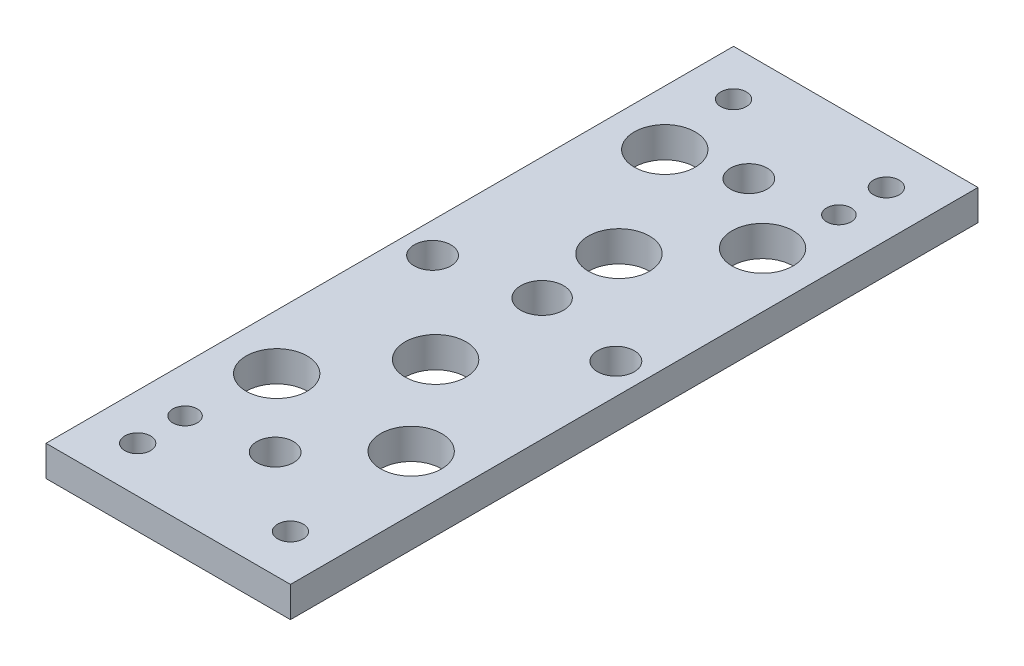
from build123d import *

# Parameters (mm, degrees)
SKETCH1_W             = 80
SKETCH1_H             = 225
BOSS_EXTRUDE1_DEPTH   = 10
CUT_EXTRUDE1_REACH    = 121.818
SKETCH2_R             = 6
M8_CLEARANCE_HOLE1_D  = 8.4
F_8_0MM_DOWEL_HOLE1_D = 8
CUT_EXTRUDE3_REACH    = 121.818
SKETCH10_R            = 7
SKETCH14_R            = 10
CUT_EXTRUDE4_DEPTH    = 120.817569663


with BuildPart() as part:
    # Sketch1 → Boss-Extrude1 (new body)
    with BuildSketch(Plane(origin=(0, 0, 0), x_dir=(1, 0, 0), z_dir=(0, 1, 0))):
        Rectangle(SKETCH1_W, SKETCH1_H)
    extrude(amount=-BOSS_EXTRUDE1_DEPTH)

    # Sketch2 → Cut-Extrude1 (cut, up to next)
    with BuildSketch(Plane(origin=(0, 0, 0), x_dir=(1, 0, 0), z_dir=(0, 1, 0)), mode=Mode.PRIVATE) as cut_extrude1_sk1:
        with Locations((0, 77.5)):
            Circle(SKETCH2_R)
    cut_extrude1_tool1 = extrude(cut_extrude1_sk1.sketch, amount=-CUT_EXTRUDE1_REACH, mode=Mode.PRIVATE) & part.part
    # Sketch2 → Cut-Extrude1 (cut, up to next)
    with BuildSketch(Plane(origin=(0, 0, 0), x_dir=(1, 0, 0), z_dir=(0, 1, 0)), mode=Mode.PRIVATE) as cut_extrude1_sk2:
        with Locations((30, 4)):
            Circle(SKETCH2_R)
    cut_extrude1_tool2 = extrude(cut_extrude1_sk2.sketch, amount=-CUT_EXTRUDE1_REACH, mode=Mode.PRIVATE) & part.part
    # Sketch2 → Cut-Extrude1 (cut, up to next)
    with BuildSketch(Plane(origin=(0, 0, 0), x_dir=(1, 0, 0), z_dir=(0, 1, 0)), mode=Mode.PRIVATE) as cut_extrude1_sk3:
        with Locations((-30, 4)):
            Circle(SKETCH2_R)
    cut_extrude1_tool3 = extrude(cut_extrude1_sk3.sketch, amount=-CUT_EXTRUDE1_REACH, mode=Mode.PRIVATE) & part.part
    # Sketch2 → Cut-Extrude1 (cut, up to next)
    with BuildSketch(Plane(origin=(0, 0, 0), x_dir=(1, 0, 0), z_dir=(0, 1, 0)), mode=Mode.PRIVATE) as cut_extrude1_sk4:
        with Locations((0, -77.5)):
            Circle(SKETCH2_R)
    cut_extrude1_tool4 = extrude(cut_extrude1_sk4.sketch, amount=-CUT_EXTRUDE1_REACH, mode=Mode.PRIVATE) & part.part
    add(cut_extrude1_tool1.solids().sort_by_distance((0, 0, -77.5))[0], mode=Mode.SUBTRACT)
    add(cut_extrude1_tool2.solids().sort_by_distance((30, 0, -4))[0], mode=Mode.SUBTRACT)
    add(cut_extrude1_tool3.solids().sort_by_distance((-30, 0, -4))[0], mode=Mode.SUBTRACT)
    add(cut_extrude1_tool4.solids().sort_by_distance((0, 0, 77.5))[0], mode=Mode.SUBTRACT)

    # M8 Clearance Hole1 (through all)
    with Locations(Plane(origin=(0, 0, 0), x_dir=(1, 0, 0), z_dir=(0, 1, 0))):
        with Locations((-25, 97.5), (25, 97.5), (25, -97.5), (-25, -97.5)):
            Hole(M8_CLEARANCE_HOLE1_D / 2)

    # Ø8.0mm Dowel Hole1 (through all)
    with Locations(Plane(origin=(0, 0, 0), x_dir=(1, 0, 0), z_dir=(0, 1, 0))):
        with Locations((25, 81.975), (-25, -82)):
            Hole(F_8_0MM_DOWEL_HOLE1_D / 2)

    # Sketch10 → Cut-Extrude3 (cut, up to next)
    with BuildSketch(Plane(origin=(0, 0, 0), x_dir=(1, 0, 0), z_dir=(0, 1, 0)), mode=Mode.PRIVATE) as cut_extrude3_sk1:
        with Locations((0, 9.86)):
            Circle(SKETCH10_R)
    cut_extrude3_tool1 = extrude(cut_extrude3_sk1.sketch, amount=-CUT_EXTRUDE3_REACH, mode=Mode.PRIVATE) & part.part
    add(cut_extrude3_tool1.solids().sort_by_distance((0, 0, -9.86))[0], mode=Mode.SUBTRACT)

    # Sketch14 → Cut-Extrude4 (cut, through all)
    with BuildSketch(Plane(origin=(0, -10, 0), x_dir=(1, 0, 0), z_dir=(0, 1, 0))):
        with Locations((22, 60)):
            Circle(SKETCH14_R)
        with Locations((-22, 72)):
            Circle(SKETCH14_R)
        with Locations((0, 35)):
            Circle(SKETCH14_R)
        with Locations((0, -25)):
            Circle(SKETCH14_R)
        with Locations((-22, -55)):
            Circle(SKETCH14_R)
        with Locations((22, -55)):
            Circle(SKETCH14_R)
    extrude(amount=CUT_EXTRUDE4_DEPTH, mode=Mode.SUBTRACT)


solid = part.part
